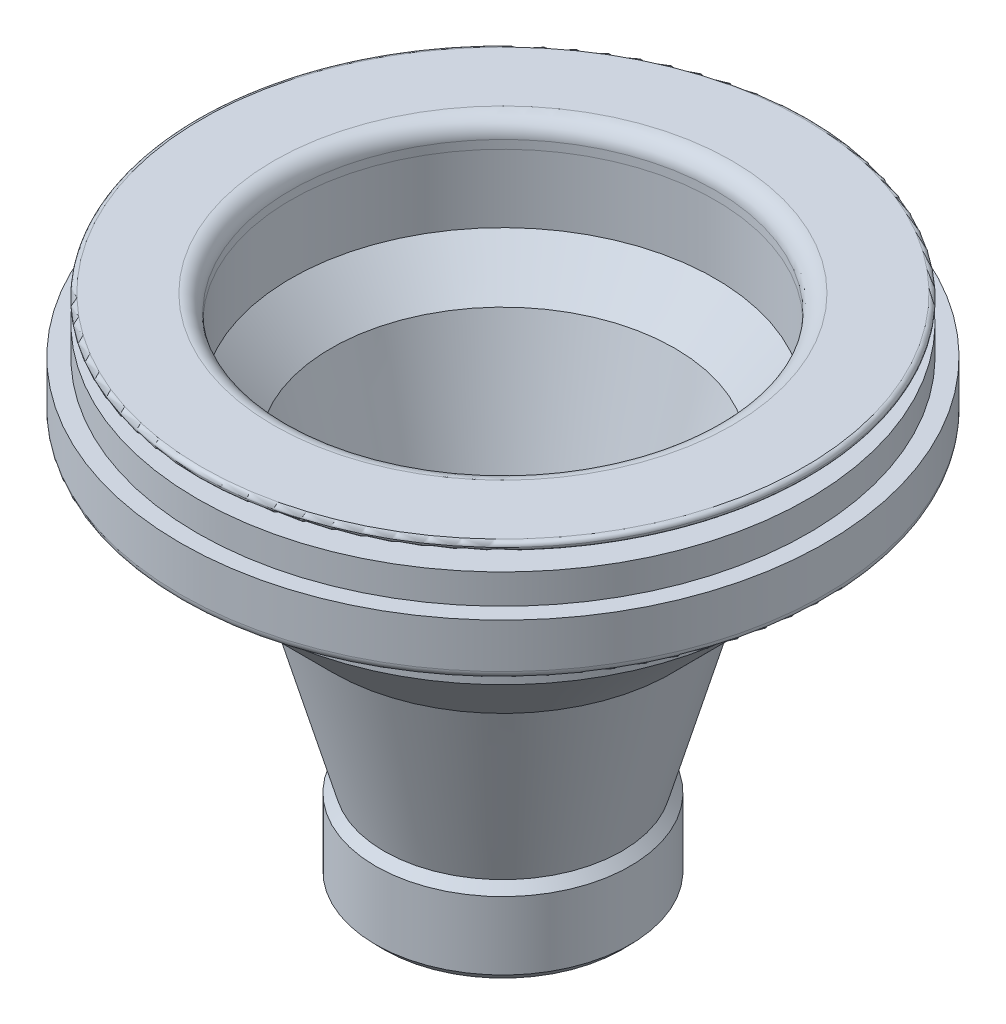
from build123d import *

# Parameters (mm, degrees)
DRAINSKETCH_3_W = 4.7625
DRAINSKETCH_3_H = 3.175
DRAININFILLET_R = 3.175
RIMFILLET_R     = 0.79375


with BuildPart() as part:
    # DrainSketch → DrainUnderRevolve (revolve)
    with BuildSketch(Plane.XY.offset(-317.5), mode=Mode.PRIVATE) as drainunderrevolve_sk:
        Polygon((717.55, -272.653125), (712.106073113, -272.653125), (704.85, -298.29125), (704.85, -306.308125), (708.025, -306.308125), align=None)
        Polygon((733.425, -256.778125), (716.598997642, -256.778125), (712.106073113, -272.653125), (717.55, -272.653125), align=None)
        Polygon((733.425, -247.253125), (722.709375, -247.253125), (717.946875, -252.015625), (716.598997642, -256.778125), (733.425, -256.778125), align=None)
        with BuildLine():
            Line((746.125, -245.26875), (724.69375, -245.26875))
            Line((724.69375, -245.26875), (722.709375, -247.253125))
            Line((722.709375, -247.253125), (733.425, -247.253125))
            Line((733.425, -247.253125), (744.5375, -247.253125))
            ThreePointArc((744.5375, -247.253125), (745.660032015, -246.788157015), (746.125, -245.665625))
            Line((746.125, -245.665625), (746.125, -245.26875))
        make_face()
        Polygon((742.95, -237.33125), (725.4875, -237.33125), (725.4875, -244.475), (724.69375, -245.26875), (746.125, -245.26875), (746.125, -237.33125), align=None)
        Polygon((730.25, -231.775), (725.4875, -231.775), (725.4875, -237.33125), (742.95, -237.33125), (742.95, -231.775), align=None)
        Polygon((708.025, -306.308125), (704.85, -306.308125), (704.85, -322.2625), (708.025, -322.2625), (709.6125, -320.6353125), (709.6125, -307.9353125), align=None)
    revolve(drainunderrevolve_sk.sketch.rotate(Axis((685.8, -228.6, -317.5), (0, -1, 0)), 90), axis=Axis((685.8, -228.6, -317.5), (0, -1, 0)))


with BuildPart() as body_2:
    # DrainSketch<3> → DrainPlateRevolve (revolve)
    with BuildSketch(Plane.XY.offset(-317.5), mode=Mode.PRIVATE) as drainplaterevolve_sk:
        with Locations((727.86875, -230.1875)):
            Rectangle(DRAINSKETCH_3_W, DRAINSKETCH_3_H)
        Polygon((725.4875, -227.0125), (725.4875, -228.6), (730.25, -228.6), (742.95, -228.6), (742.95, -227.0125), align=None)
    revolve(drainplaterevolve_sk.sketch.rotate(Axis((685.8, -228.6, -317.5), (0, -1, 0)), 90), axis=Axis((685.8, -228.6, -317.5), (0, -1, 0)))

    # DrainInFillet
    draininfillet_edges = [body_2.edges().sort_by_distance(p)[0] for p in [
        (685.8, -227.0125, -357.1875),
    ]]
    fillet(draininfillet_edges, radius=DRAININFILLET_R)

    # RimFillet
    rimfillet_edges = [body_2.edges().sort_by_distance(p)[0] for p in [
        (685.8, -227.0125, -374.65),
        (685.8, -228.6, -374.65),
    ]]
    fillet(rimfillet_edges, radius=RIMFILLET_R - 0.0001)  # a hair under: the kernel refuses the full size


solid = Compound([part.part, body_2.part])
